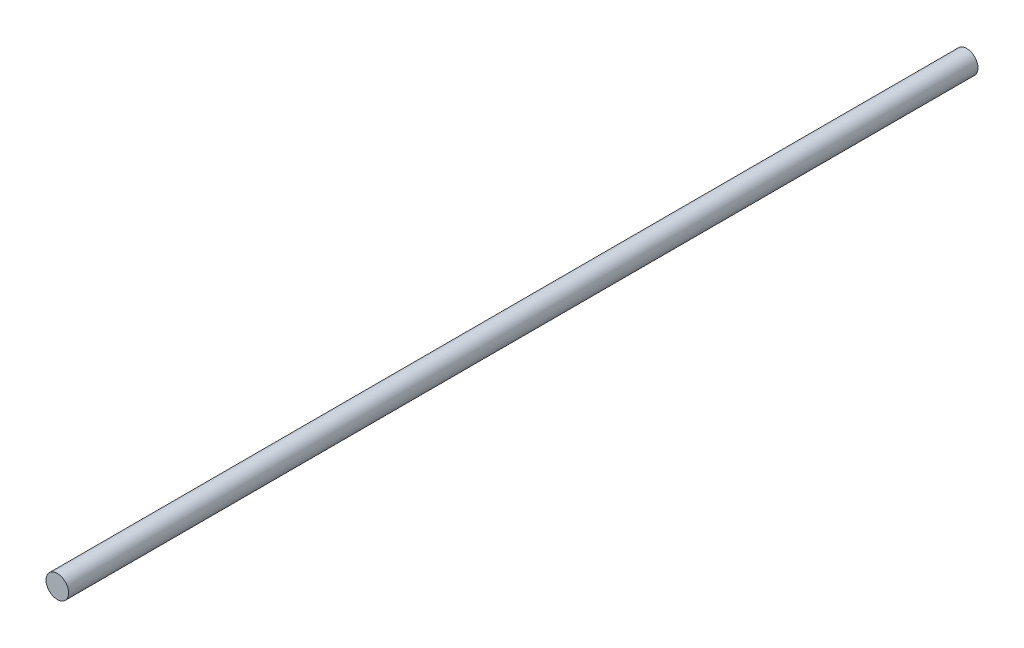
from build123d import *

# Parameters (mm, degrees)
SKETCH1_R           = 4.5
BOSS_EXTRUDE1_DEPTH = 361.8


with BuildPart() as part:
    # Sketch1 → Boss-Extrude1 (new body)
    with BuildSketch(Plane.XY):
        Circle(SKETCH1_R)
    extrude(amount=BOSS_EXTRUDE1_DEPTH)


solid = part.part
